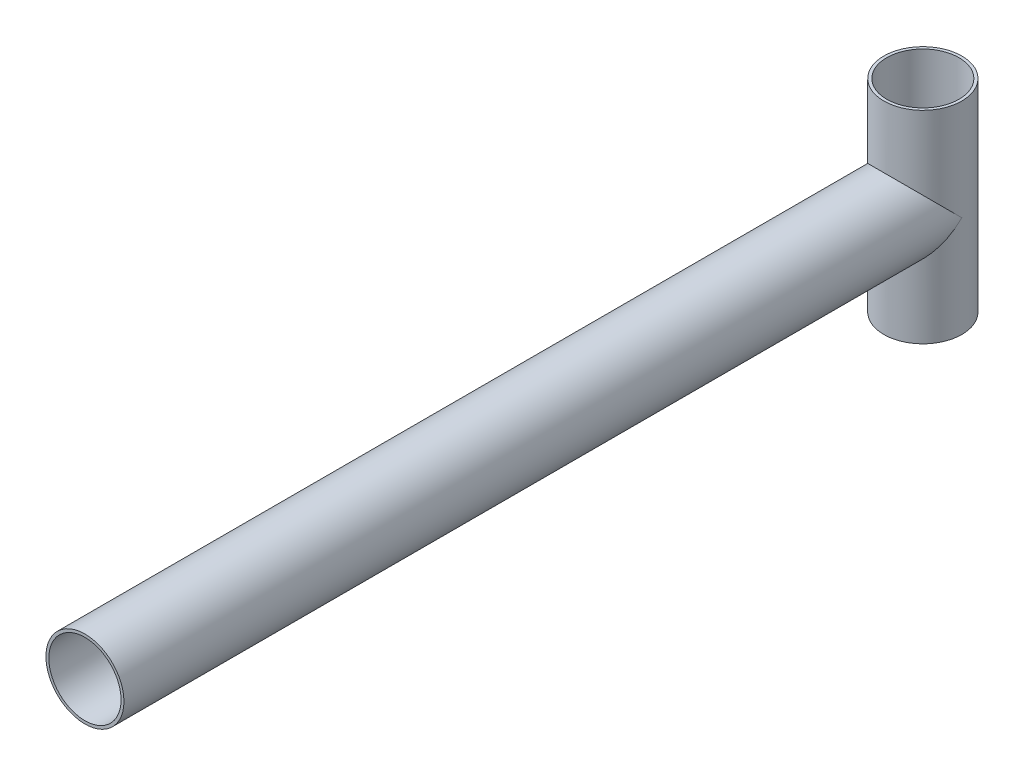
from build123d import *

# Parameters (mm, degrees)
SKETCH1_R           = 13.5
BOSS_EXTRUDE1_DEPTH = 35
SKETCH2_R           = 13.5
BOSS_EXTRUDE2_DEPTH = 290
SHELL1_START        = -35
SHELL1_OUTLINE_R    = 12.5
SHELL1_DEPTH        = 70
SHELL1_START_2      = -1e-07
SHELL1_2_OUTLINE_R  = 12.5
SHELL1_2_DEPTH      = 290.0000001


with BuildPart() as part:
    # Sketch1 → Boss-Extrude1 (new, symmetric)
    with BuildSketch(Plane(origin=(0, 0, 0), x_dir=(1, 0, 0), z_dir=(0, 1, 0))):
        with Locations(Location((0, 0, 0), (0, 0, 270))):
            Circle(SKETCH1_R)
    extrude(amount=BOSS_EXTRUDE1_DEPTH, both=True)

    # Sketch2 → Boss-Extrude2 (add)
    with BuildSketch(Plane.XY):
        Circle(SKETCH2_R)
    extrude(amount=BOSS_EXTRUDE2_DEPTH)

    # Shell1: read off the stored shape, not the designer's step
    # Shell1 outline → Shell1 (cut)
    with BuildSketch(Plane(origin=(0, 0, 0), x_dir=(1, 0, 0), z_dir=(0, 1, 0)).offset(SHELL1_START)):
        Circle(SHELL1_OUTLINE_R)
    extrude(amount=SHELL1_DEPTH, mode=Mode.SUBTRACT)

    # Shell1 2 outline → Shell1 2 (cut)
    with BuildSketch(Plane.XY.offset(SHELL1_START_2)):
        Circle(SHELL1_2_OUTLINE_R)
    extrude(amount=SHELL1_2_DEPTH, mode=Mode.SUBTRACT)


solid = part.part
